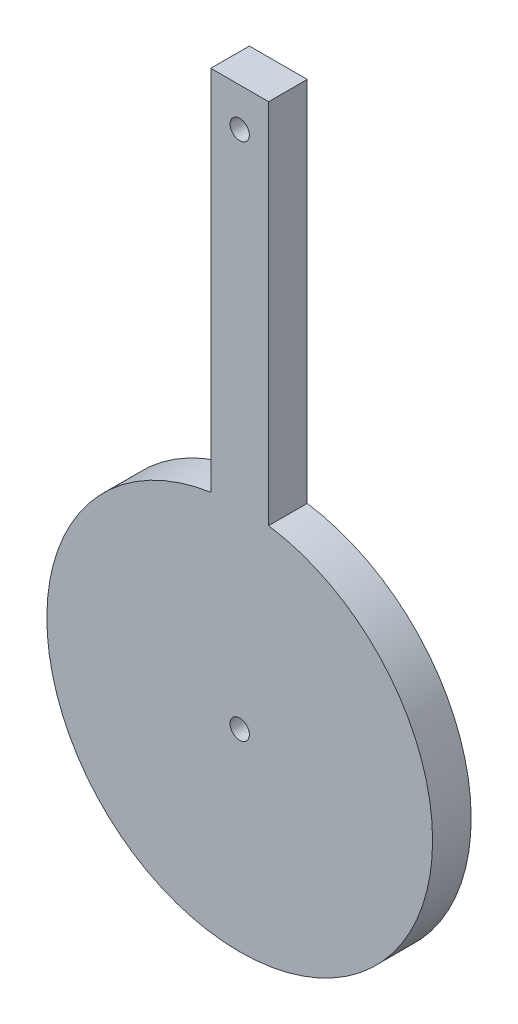
from build123d import *

# Parameters (mm, degrees)
BASE_FLANGE1_DEPTH = 10
CUT_EXTRUDE1_REACH = 155.346
SKETCH7_R          = 2.5


# Sheet-metal steps are written as plain solids
with BuildPart() as part:
    # Sketch2 → Base-Flange1 (new body)
    with BuildSketch(Plane.XY):
        with BuildLine():
            Line((7.5, 49.434299833), (7.5, 144.62))
            Line((7.5, 144.62), (-7.5, 144.62))
            Line((-7.5, 144.62), (-7.5, 49.434299833))
            ThreePointArc((-7.5, 49.434299833), (0, -50), (7.5, 49.434299833))
        make_face()
    extrude(amount=-BASE_FLANGE1_DEPTH)

    # Sketch7 → Cut-Extrude1 (cut, up to next)
    with BuildSketch(Plane.XY, mode=Mode.PRIVATE) as cut_extrude1_sk1:
        with Locations((0, 134.62)):
            Circle(SKETCH7_R)
    cut_extrude1_tool1 = extrude(cut_extrude1_sk1.sketch, amount=-CUT_EXTRUDE1_REACH, mode=Mode.PRIVATE) & part.part
    # Sketch7 → Cut-Extrude1 (cut, up to next)
    with BuildSketch(Plane.XY, mode=Mode.PRIVATE) as cut_extrude1_sk2:
        Circle(SKETCH7_R)
    cut_extrude1_tool2 = extrude(cut_extrude1_sk2.sketch, amount=-CUT_EXTRUDE1_REACH, mode=Mode.PRIVATE) & part.part
    add(cut_extrude1_tool1.solids().sort_by_distance((0, 134.62, 0))[0], mode=Mode.SUBTRACT)
    add(cut_extrude1_tool2.solids().sort_by_distance((0, 0, 0))[0], mode=Mode.SUBTRACT)


solid = part.part
